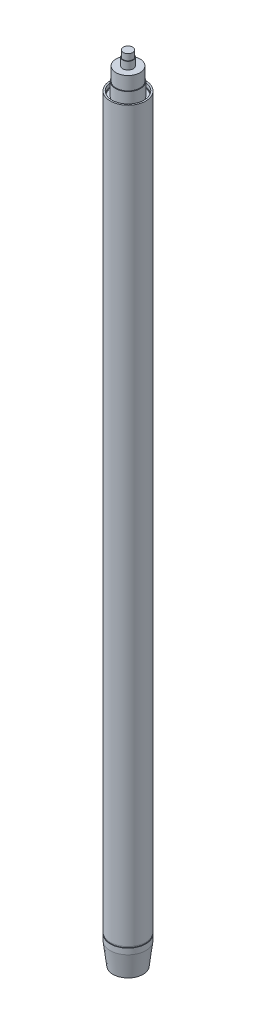
from build123d import *

# Parameters (mm, degrees)
SKETCH1_R           = 26.7208
SKETCH1_R_2         = 24.3332
BOSS_EXTRUDE1_DEPTH = 1111.25
SKETCH2_W           = 2.54
SKETCH2_H           = 2.032
SKETCH3_W           = 1.27
SKETCH3_H           = 2.032
SKETCH5_R           = 23.876
BOSS_EXTRUDE2_DEPTH = 12.7
SKETCH6_R           = 18.034
BOSS_EXTRUDE4_DEPTH = 39.878
SKETCH7_R           = 7.9375
SKETCH7_R_2         = 3.175
BOSS_EXTRUDE5_DEPTH = 11.43
SKETCH9_R           = 7.112
BOSS_EXTRUDE6_DEPTH = 9.398
SKETCH10_R          = 19.05
BOSS_EXTRUDE7_DEPTH = 19.685


with BuildPart() as part:
    # Sketch1 → Boss-Extrude1 (new body)
    with BuildSketch(Plane(origin=(0, 0, 0), x_dir=(1, 0, 0), z_dir=(0, 1, 0))):
        Circle(SKETCH1_R)
        Circle(SKETCH1_R_2, mode=Mode.SUBTRACT)
    extrude(amount=BOSS_EXTRUDE1_DEPTH)

    # Sketch2 → Cut-Revolve1 (revolve, cut)
    with BuildSketch(Plane.XY):
        with Locations((23.8252, 6.096)):
            Rectangle(SKETCH2_W, SKETCH2_H)
    cut_revolve1 = revolve(axis=Axis((0, 1111.25, 0), (0, -1, 0)), mode=Mode.SUBTRACT)

    # Mirror1: Cut-Revolve1 across plane
    add(cut_revolve1.mirror(Plane(origin=(0, 555.625, 0), x_dir=(0, 0, 1), z_dir=(0, -1, 0))), mode=Mode.SUBTRACT)

    # Sketch3 → Cut-Revolve2 (revolve, cut)
    with BuildSketch(Plane(origin=(0, 0, 0), x_dir=(0, 0, -1), z_dir=(1, 0, 0))):
        with Locations((26.5938, 9.779)):
            Rectangle(SKETCH3_W, SKETCH3_H)
    revolve(axis=Axis((0, 1111.25, 0), (0, -1, 0)), mode=Mode.SUBTRACT)

    # Sketch4 → Revolve2 (revolve)
    with BuildSketch(Plane.XY):
        Polygon((26.7208, 0), (22.6695, -33.147), (20.2819, -33.147), (24.3332, 0), align=None)
    revolve(axis=Axis((0, 1111.25, 0), (0, -1, 0)))


with BuildPart() as body_2:
    # Sketch5 → Boss-Extrude2 (new body)
    with BuildSketch(Plane(origin=(0, 1104.138, 0), x_dir=(1, 0, 0), z_dir=(0, 1, 0))):
        Circle(SKETCH5_R)
    extrude(amount=-BOSS_EXTRUDE2_DEPTH)

    # Sketch6 → Boss-Extrude4 (add)
    with BuildSketch(Plane(origin=(0, 1104.138, 0), x_dir=(1, 0, 0), z_dir=(0, 1, 0))):
        Circle(SKETCH6_R)
    extrude(amount=BOSS_EXTRUDE4_DEPTH)

    # Sketch7 → Boss-Extrude5 (add)
    with BuildSketch(Plane(origin=(0, 1144.016, 0), x_dir=(1, 0, 0), z_dir=(0, 1, 0))):
        Circle(SKETCH7_R)
        Circle(SKETCH7_R_2, mode=Mode.SUBTRACT)
    extrude(amount=BOSS_EXTRUDE5_DEPTH)

    # Sketch9 → Boss-Extrude6 (add)
    with BuildSketch(Plane(origin=(0, 1155.446, 0), x_dir=(1, 0, 0), z_dir=(0, 1, 0))):
        Circle(SKETCH9_R)
    extrude(amount=BOSS_EXTRUDE6_DEPTH)

    # Sketch10 → Boss-Extrude7 (add)
    with BuildSketch(Plane(origin=(0, 1104.138, 0), x_dir=(1, 0, 0), z_dir=(0, 1, 0))):
        Circle(SKETCH10_R)
    extrude(amount=BOSS_EXTRUDE7_DEPTH)


solid = Compound([part.part, body_2.part])
